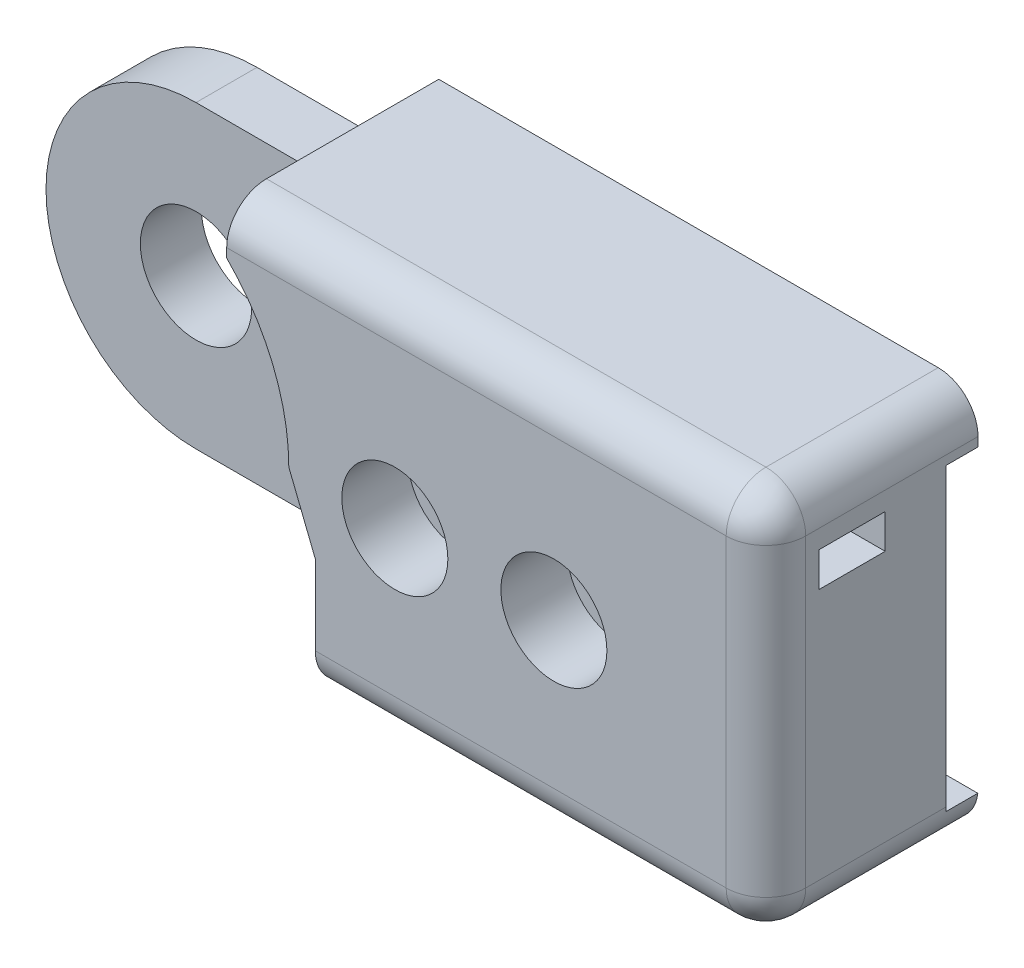
from build123d import *

# Parameters (mm, degrees)
BOSS_EXTRUDE1_DEPTH = 2
BOSS_EXTRUDE2_START = 2.5
BOSS_EXTRUDE2_DEPTH = 2.5
CUT_EXTRUDE1_DEPTH  = 2.5
BOSS_EXTRUDE3_DEPTH = 2.3
SKETCH9_R           = 2.1
CUT_EXTRUDE2_DEPTH  = 2.5
SKETCH10_R          = 2.5
BOSS_EXTRUDE4_DEPTH = 1.2
SKETCH11_R          = 0.95
CUT_EXTRUDE3_DEPTH  = 9.2
SKETCH12_R          = 2
CUT_EXTRUDE4_DEPTH  = 2.5
SKETCH14_W          = 20.343145751
SKETCH14_H          = 1.841510486
SKETCH14_W_2        = 17
SKETCH14_H_2        = 1.34163614
BOSS_EXTRUDE5_DEPTH = 1.2
FILLET1_R           = 1.5
SKETCH17_R          = 0.95
CUT_EXTRUDE5_DEPTH  = 3


# Read off the part's stored shape, not the designer's step: Boss-Extrude3
with BuildPart() as part:
    # Sketch5 → Boss-Extrude1 (new body)
    with BuildSketch(Plane.XY):
        with BuildLine():
            Line((8, 0), (9, -2.501635265))
            Line((9, -2.501635265), (9, -7.001635265))
            Line((9, -7.001635265), (26, -7.001635265))
            Line((26, -7.001635265), (26, 7.498364735))
            Line((26, 7.498364735), (5.656854249, 7.498364735))
            Line((5.656854249, 7.498364735), (5.656854249, 5.656854249))
            ThreePointArc((5.656854249, 5.656854249), (7.39103626, 3.061467459), (8, 0))
        make_face()
    extrude(amount=BOSS_EXTRUDE1_DEPTH)

    # Sketch6 → Boss-Extrude2 (add)
    with BuildSketch(Plane(origin=(0, 0, 0), x_dir=(-1, 0, 0), z_dir=(0, 0, -1)).offset(BOSS_EXTRUDE2_START)):
        with BuildLine():
            Line((-5.656854249, 7.498364735), (-5.656854249, 5.656854249))
            ThreePointArc((-5.656854249, 5.656854249), (-7.39103626, 3.061467459), (-8, 0))
            Line((-8, 0), (-9, -2.501635265))
            Line((-9, -2.501635265), (-9, -7.001635265))
            Line((-9, -7.001635265), (-26, -7.001635265))
            Line((-26, -7.001635265), (-26, 7.498364735))
            Line((-26, 7.498364735), (-5.656854249, 7.498364735))
        make_face()
    extrude(amount=-BOSS_EXTRUDE2_DEPTH)

    # Sketch7 → Cut-Extrude1 (cut)
    with BuildSketch(Plane(origin=(0, 0, -2.5), x_dir=(-1, 0, 0), z_dir=(0, 0, -1))):
        Polygon((-26, 5.298364735), (-2.738141148, 5.298364735), (-2.738141148, 3.998364735), (-29.849535112, 3.998364735), (-29.849535112, 5.298364735), align=None)
    extrude(amount=-CUT_EXTRUDE1_DEPTH, mode=Mode.SUBTRACT)

    # Boss-Extrude3 outline → Boss-Extrude3 (add)
    with BuildSketch(Plane(origin=(0, 0, -2.5), x_dir=(-1, 0, 0), z_dir=(0, 0, -1))):
        with BuildLine():
            Line((-9, -7.001635265), (-9, -5.659999125))
            Line((-9, -5.659999125), (0, -5.659998688))
            ThreePointArc((0, -5.659998688), (5.659998688, 0), (0, 5.659998688))
            Line((0, 5.659998688), (-5.656854249, 5.656854249))
            Line((-5.656854249, 5.656854249), (-5.656854249, 7.498364735))
            Line((-5.656854249, 7.498364735), (-26, 7.498364735))
            Line((-26, 7.498364735), (-26, -7.001635265))
            Line((-26, -7.001635265), (-9, -7.001635265))
        make_face()
    extrude(amount=BOSS_EXTRUDE3_DEPTH)

    # Sketch9 → Cut-Extrude2 (cut)
    with BuildSketch(Plane(origin=(0, 0, -4.8), x_dir=(-1, 0, 0), z_dir=(0, 0, -1))):
        Circle(SKETCH9_R)
    extrude(amount=-CUT_EXTRUDE2_DEPTH, mode=Mode.SUBTRACT)

    # Sketch10 → Boss-Extrude4 (add)
    with BuildSketch(Plane(origin=(0, 0, -4.8), x_dir=(-1, 0, 0), z_dir=(0, 0, -1))):
        with Locations((-12, 0)):
            Circle(SKETCH10_R)
        with Locations((-18, 0)):
            Circle(SKETCH10_R)
    extrude(amount=BOSS_EXTRUDE4_DEPTH)

    # Sketch11 → Cut-Extrude3 (cut)
    with BuildSketch(Plane(origin=(0, 0, -6), x_dir=(-1, 0, 0), z_dir=(0, 0, -1))):
        with Locations((-18, 0)):
            Circle(SKETCH11_R)
        with Locations((-12, 0)):
            Circle(SKETCH11_R)
    extrude(amount=-CUT_EXTRUDE3_DEPTH, mode=Mode.SUBTRACT)

    # Sketch12 → Cut-Extrude4 (cut)
    with BuildSketch(Plane.XY.offset(2)):
        with Locations((12, 0)):
            Circle(SKETCH12_R)
        with Locations((18, 0)):
            Circle(SKETCH12_R)
    extrude(amount=-CUT_EXTRUDE4_DEPTH, mode=Mode.SUBTRACT)

    # Sketch14 → Boss-Extrude5 (add)
    with BuildSketch(Plane(origin=(0, 0, -4.8), x_dir=(-1, 0, 0), z_dir=(0, 0, -1))):
        with Locations((-15.828427124, 6.577609492)):
            Rectangle(SKETCH14_W, SKETCH14_H)
        with Locations((-17.5, -6.330817195)):
            Rectangle(SKETCH14_W_2, SKETCH14_H_2)
    extrude(amount=BOSS_EXTRUDE5_DEPTH)

    # Fillet1
    # the kernel refuses this fillet: 1.5 mm, written as the material it takes off along each edge
    with BuildSketch(Plane(origin=(24.5, -5.501635265, 0.5), x_dir=(0, 0, 1), z_dir=(0, -1, 0))) as fillet1_piece_1_section:
        Polygon((0, 0), (FILLET1_R, 0), (FILLET1_R, -FILLET1_R), (0, -FILLET1_R), align=None)
    fillet1_piece_1 = extrude(amount=FILLET1_R, mode=Mode.PRIVATE)
    fillet1_piece_1 = fillet1_piece_1 - Plane(origin=(24.5, -5.501635265, 0.5), x_dir=(-0.7071067811865475, 0, -0.7071067811865475), z_dir=(0, -1, 0)) * Sphere(FILLET1_R, mode=Mode.PRIVATE)
    add(fillet1_piece_1, mode=Mode.SUBTRACT)
    with BuildSketch(Plane(origin=(24.5, 5.998364735, 0.5), x_dir=(0, 0, 1), z_dir=(0, 1, 0))) as fillet1_piece_2_section:
        Polygon((0, 0), (FILLET1_R, 0), (FILLET1_R, FILLET1_R), (0, FILLET1_R), align=None)
    fillet1_piece_2 = extrude(amount=FILLET1_R, mode=Mode.PRIVATE)
    fillet1_piece_2 = fillet1_piece_2 - Plane(origin=(24.5, 5.998364735, 0.5), x_dir=(-0.7071067811865475, 0, -0.7071067811865475), z_dir=(0, 1, 0)) * Sphere(FILLET1_R, mode=Mode.PRIVATE)
    add(fillet1_piece_2, mode=Mode.SUBTRACT)
    with BuildSketch(Plane(origin=(26, -5.501635265, 2), x_dir=(-1, 0, 0), z_dir=(0, 1, 0))) as fillet1_piece_3:
        with BuildLine():
            CenterArc((FILLET1_R, -FILLET1_R), FILLET1_R, 90, 90)
            Line((0, -FILLET1_R), (0, 0))
            Line((0, 0), (FILLET1_R, 0))
        make_face()
    extrude(amount=11.5, mode=Mode.SUBTRACT)
    with BuildSketch(Plane(origin=(26, -7.001635265, -2.5), x_dir=(-1, 0, 0), z_dir=(0, 0, 1))) as fillet1_piece_4:
        with BuildLine():
            CenterArc((FILLET1_R, -FILLET1_R), FILLET1_R, 90, 90)
            Line((0, -FILLET1_R), (0, 0))
            Line((0, 0), (FILLET1_R, 0))
        make_face()
    extrude(amount=3, mode=Mode.SUBTRACT)
    with BuildSketch(Plane(origin=(5.25, -7.001635265, 2), x_dir=(0, 1, 0), z_dir=(1, 0, 0))) as fillet1_piece_5:
        with BuildLine():
            CenterArc((FILLET1_R, -FILLET1_R), FILLET1_R, 90, 90)
            Line((0, -FILLET1_R), (0, 0))
            Line((0, 0), (FILLET1_R, 0))
        make_face()
    extrude(amount=19.25, mode=Mode.SUBTRACT)
    with BuildSketch(Plane(origin=(24.5, 7.498364735, 2), x_dir=(0, -1, 0), z_dir=(-1, 0, 0))) as fillet1_piece_6:
        with BuildLine():
            CenterArc((FILLET1_R, -FILLET1_R), FILLET1_R, 90, 90)
            Line((0, -FILLET1_R), (0, 0))
            Line((0, 0), (FILLET1_R, 0))
        make_face()
    extrude(amount=22.593145751, mode=Mode.SUBTRACT)
    with BuildSketch(Plane(origin=(26, 7.498364735, -2.5), x_dir=(-1, 0, 0), z_dir=(0, 0, 1))) as fillet1_piece_7:
        with BuildLine():
            CenterArc((FILLET1_R, FILLET1_R), FILLET1_R, 180, 90)
            Line((0, FILLET1_R), (0, 0))
            Line((0, 0), (FILLET1_R, 0))
        make_face()
    extrude(amount=3, mode=Mode.SUBTRACT)
    with BuildSketch(Plane(origin=(26, 7.498364735, -2.5), x_dir=(-1.0, -1.9174232572065026e-10, 0), z_dir=(0, 0, -1))) as fillet1_piece_8:
        with BuildLine():
            CenterArc((FILLET1_R, -FILLET1_R), FILLET1_R, 90.000000011, 90)
            Line((FILLET1_R * 1.9173522033e-10, -FILLET1_R), (0, 0))
            Line((0, 0), (FILLET1_R, 0))
        make_face()
    extrude(amount=2.3, mode=Mode.SUBTRACT)
    with BuildSketch(Plane(origin=(26, 7.498364735, -4.8), x_dir=(-1, 0, 0), z_dir=(0, 0, -1))) as fillet1_piece_9:
        with BuildLine():
            CenterArc((FILLET1_R, -FILLET1_R), FILLET1_R, 90, 90)
            Line((0, -FILLET1_R), (0, 0))
            Line((0, 0), (FILLET1_R, 0))
        make_face()
    extrude(amount=4.95, mode=Mode.SUBTRACT)
    with BuildSketch(Plane(origin=(26, -7.001635265, -2.5), x_dir=(-1.0, -1.9169850891861218e-10, 0), z_dir=(0, 0, -1))) as fillet1_piece_10:
        with BuildLine():
            CenterArc((FILLET1_R, FILLET1_R), FILLET1_R, 180.000000011, 90)
            Line((-FILLET1_R * 1.91707982785e-10, FILLET1_R), (0, 0))
            Line((0, 0), (FILLET1_R, 0))
        make_face()
    extrude(amount=2.3, mode=Mode.SUBTRACT)
    with BuildSketch(Plane(origin=(26, -7.001635265, -4.8), x_dir=(-1, 0, 0), z_dir=(0, 0, -1))) as fillet1_piece_11:
        with BuildLine():
            CenterArc((FILLET1_R, FILLET1_R), FILLET1_R, 180, 90)
            Line((0, FILLET1_R), (0, 0))
            Line((0, 0), (FILLET1_R, 0))
        make_face()
    extrude(amount=4.95, mode=Mode.SUBTRACT)

    # Sketch17 → Cut-Extrude5 (cut)
    with BuildSketch(Plane.XZ.offset(7.001635265)):
        with Locations((22, -1)):
            Circle(SKETCH17_R)
        with Locations((18, -1)):
            Circle(SKETCH17_R)
    extrude(amount=-CUT_EXTRUDE5_DEPTH, mode=Mode.SUBTRACT)


solid = part.part
